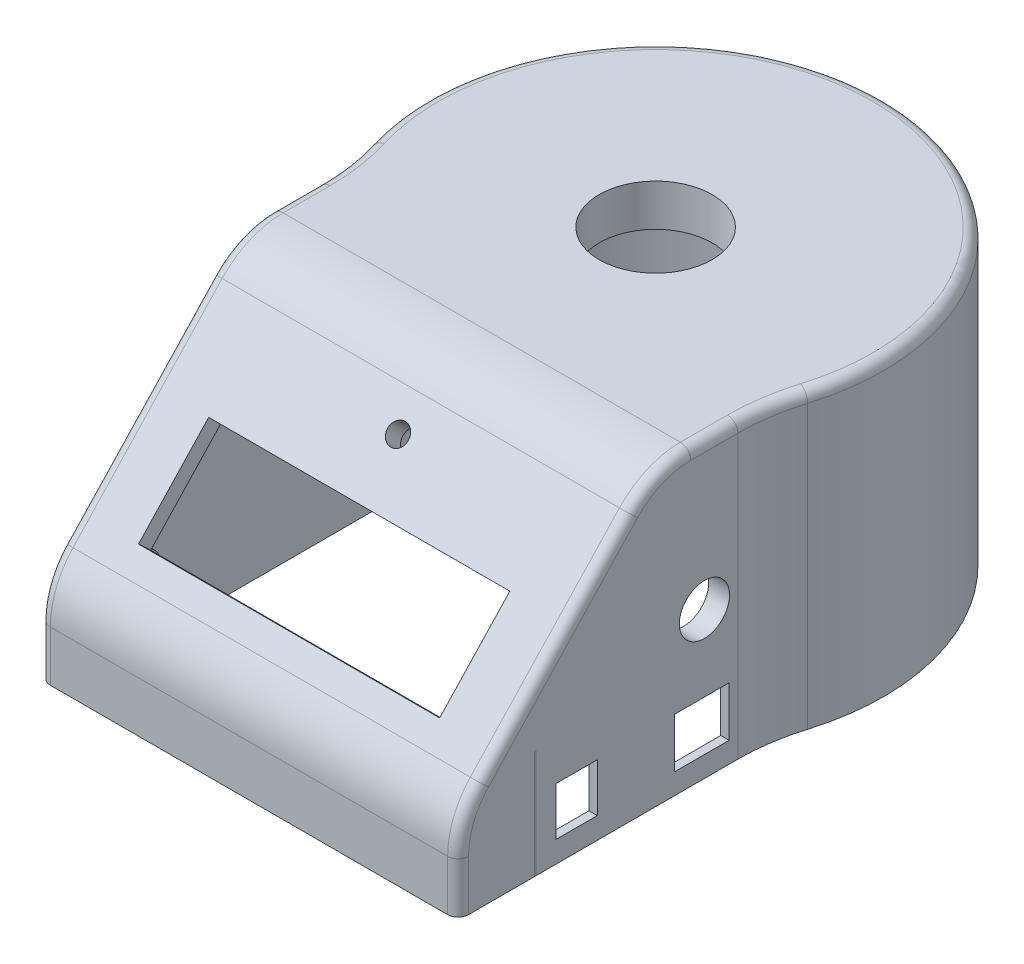
from build123d import *

# Parameters (mm, degrees)
SKETCH1_R                             = 54.5
SKETCH1_R_2                           = 50
BOSS_EXTRUDE1_DEPTH                   = 60
SKETCH2_R                             = 54.5
SKETCH2_R_2                           = 13.5
BOSS_EXTRUDE2_DEPTH                   = 10
BOSS_EXTRUDE4_DEPTH                   = 70
CUT_EXTRUDE3_DEPTH                    = 100
SHELL1_DEPTH                          = 65
SHELL1_START                          = 79.546448744
SHELL1_2_OUTLINE_W                    = 92
SHELL1_2_OUTLINE_H                    = 68
SHELL1_2_DEPTH                        = 5
CUT_EXTRUDE4_DEPTH                    = 60
SKETCH12_W                            = 72
SKETCH12_H                            = 24.5
CUT_EXTRUDE5_DEPTH                    = 4
SKETCH13_W                            = 80
SKETCH13_H                            = 36
CUT_EXTRUDE6_DEPTH                    = 1
SKETCH15_R                            = 2.75
BOSS_EXTRUDE5_DEPTH                   = 7
M3_CLEARANCE_HOLE1_D                  = 3.4
M3_CLEARANCE_HOLE1_DEPTH              = 5
M3_CLEARANCE_HOLE1_CSINK_D            = 3.45
M3_CLEARANCE_HOLE1_CSINK_ANGLE        = 90
M3_CLEARANCE_HOLE1_TIP                = 1.021463052
SKETCH19_R                            = 5
BOSS_EXTRUDE6_DEPTH                   = 15
BOSS_EXTRUDE6_2_DEPTH                 = 15
BOSS_EXTRUDE7_DEPTH                   = 15
SKETCH21_R                            = 5
BOSS_EXTRUDE8_DEPTH                   = 15
TAP_DRILL_FOR_M4X0_7_TAP1_D           = 3.3
TAP_DRILL_FOR_M4X0_7_TAP1_DEPTH       = 15
TAP_DRILL_FOR_M4X0_7_TAP1_CSINK_D     = 3.35
TAP_DRILL_FOR_M4X0_7_TAP1_CSINK_ANGLE = 90
SKETCH24_W                            = 57.3
SKETCH24_H                            = 26
CUT_EXTRUDE7_DEPTH                    = 5
SKETCH25_W                            = 57.3
SKETCH25_H                            = 26
SKETCH25_W_2                          = 12.999996543
SKETCH25_H_2                          = 11.900000274
SKETCH25_W_3                          = 9.900001809
SKETCH25_H_3                          = 11.55991244
BOSS_EXTRUDE9_DEPTH                   = 2
SKETCH26_W                            = 0.338668116
SKETCH26_H                            = 26
BOSS_EXTRUDE10_DEPTH                  = 2
FILLET1_R                             = 50
FILLET2_R                             = 20
FILLET3_R                             = 20
FILLET4_R                             = 2.5
SKETCH27_R                            = 2.5
CUT_EXTRUDE8_DEPTH                    = 5
SKETCH30_W                            = 6
SKETCH30_H                            = 5.001


with BuildPart() as part:
    # Sketch1 → Boss-Extrude1 (new body)
    with BuildSketch(Plane(origin=(0, 0, 0), x_dir=(1, 0, 0), z_dir=(0, 1, 0))):
        with Locations(Location((0, 0, 0), (0, 0, 270))):
            Circle(SKETCH1_R)
        with Locations(Location((0, 0, 0), (0, 0, 270))):
            Circle(SKETCH1_R_2, mode=Mode.SUBTRACT)
    extrude(amount=BOSS_EXTRUDE1_DEPTH)

    # Sketch2 → Boss-Extrude2 (add)
    with BuildSketch(Plane(origin=(0, 60, 0), x_dir=(1, 0, 0), z_dir=(0, 1, 0))):
        with Locations(Location((0, 0, 0), (0, 0, 270))):
            Circle(SKETCH2_R)
        with Locations(Location((0, 0, 0), (0, 0, 270))):
            Circle(SKETCH2_R_2, mode=Mode.SUBTRACT)
    extrude(amount=BOSS_EXTRUDE2_DEPTH)

    # Sketch3 → Boss-Extrude4 (add)
    with BuildSketch(Plane.XZ):
        with BuildLine():
            Line((-50, 0), (-50, 97.235188276))
            Line((-50, 97.235188276), (50, 97.235188276))
            Line((50, 97.235188276), (50, 0))
            ThreePointArc((50, 0), (0, 50), (-50, 0))
        make_face()
    extrude(amount=-BOSS_EXTRUDE4_DEPTH)

    # Sketch4 → Cut-Extrude3 (cut)
    with BuildSketch(Plane(origin=(50, 0, 0), x_dir=(0, 0, -1), z_dir=(1, 0, 0))):
        Polygon((-97.235188276, 70), (-97.235188276, 20), (-50.235188276, 70), align=None)
    extrude(amount=-CUT_EXTRUDE3_DEPTH, mode=Mode.SUBTRACT)

    # Shell1: read off the stored shape, not the designer's step
    # Shell1 outline → Shell1 (cut)
    with BuildSketch(Plane(origin=(0, 0, 0), x_dir=(1, 0, 0), z_dir=(0, 1, 0))):
        with BuildLine():
            Line((45, -92.235188276), (45, -31.622776602))
            ThreePointArc((45, -31.622776602), (0, -55), (-45, -31.622776602))
            Line((-45, -31.622776602), (-45, -92.235188276))
            Line((-45, -92.235188276), (45, -92.235188276))
        make_face()
    extrude(amount=SHELL1_DEPTH, mode=Mode.SUBTRACT)

    # Shell1 2 outline → Shell1 2 (add)
    with BuildSketch(Plane(origin=(0, 0, 0), x_dir=(1, 0, 0), z_dir=(0, 0.6849100087678871, 0.7286276689020071)).offset(SHELL1_START)):
        with Locations((0, -18)):
            Rectangle(SHELL1_2_OUTLINE_W, SHELL1_2_OUTLINE_H)
    extrude(amount=SHELL1_2_DEPTH)

    # Sketch5 → Cut-Extrude4 (cut)
    with BuildSketch(Plane.XZ):
        with BuildLine():
            Line((-45, 31.622776602), (-45, 21.794494718))
            ThreePointArc((-45, 21.794494718), (0, 50), (45, 21.794494718))
            Line((45, 21.794494718), (45, 31.622776602))
            ThreePointArc((45, 31.622776602), (0, 55), (-45, 31.622776602))
        make_face()
    extrude(amount=-CUT_EXTRUDE4_DEPTH, mode=Mode.SUBTRACT)

    # Sketch12 → Cut-Extrude5 (cut)
    with BuildSketch(Plane(origin=(0, 57.906708951, 61.602881862), x_dir=(1, 0, 0), z_dir=(0, 0.6849100087678871, 0.7286276689020071))):
        with Locations((0, -25.774800277)):
            Rectangle(SKETCH12_W, SKETCH12_H)
    extrude(amount=-CUT_EXTRUDE5_DEPTH, mode=Mode.SUBTRACT)

    # Sketch13 → Cut-Extrude6 (cut)
    with BuildSketch(Plane(origin=(0, 54.482158907, 57.959743518), x_dir=(-1, 0, 0), z_dir=(0, -0.6849100087678871, -0.7286276689020071))):
        with Locations((0, -25.024800277)):
            Rectangle(SKETCH13_W, SKETCH13_H)
    extrude(amount=-CUT_EXTRUDE6_DEPTH, mode=Mode.SUBTRACT)

    # Sketch15 → Boss-Extrude5 (add)
    with BuildSketch(Plane(origin=(0, 57.906708951, 61.602881862), x_dir=(1, 0, 0), z_dir=(0, 0.6849100087678871, 0.7286276689020071))):
        with Locations(Location((-37.5, -9.524800277, 0), (0, 0, 270))):
            Circle(SKETCH15_R)
        with Locations(Location((37.5, -9.524800277, 0), (0, 0, 270))):
            Circle(SKETCH15_R)
        with Locations(Location((-37.5, -40.524800277, 0), (0, 0, 270))):
            Circle(SKETCH15_R)
        with Locations(Location((37.5, -40.524800277, 0), (0, 0, 270))):
            Circle(SKETCH15_R)
    extrude(amount=-BOSS_EXTRUDE5_DEPTH)

    # M3 Clearance Hole1
    with Locations(Plane(origin=(0, 53.112338889, 56.50248818), x_dir=(-1, 0, 0), z_dir=(0, -0.6849100087678871, -0.728627668902007))):
        with Locations((-37.5, -9.524800277), (37.5, -9.524800277), (37.5, -40.524800277), (-37.5, -40.524800277)):
            CounterSinkHole(M3_CLEARANCE_HOLE1_D / 2, M3_CLEARANCE_HOLE1_CSINK_D / 2, depth=M3_CLEARANCE_HOLE1_DEPTH, counter_sink_angle=M3_CLEARANCE_HOLE1_CSINK_ANGLE)
            with Locations((0, 0, -(M3_CLEARANCE_HOLE1_DEPTH + M3_CLEARANCE_HOLE1_TIP / 2))):  # 118° drill point
                Cone(0, M3_CLEARANCE_HOLE1_D / 2, M3_CLEARANCE_HOLE1_TIP, mode=Mode.SUBTRACT)



with BuildPart() as body_2:
    # Sketch19 → Boss-Extrude6 (new body)
    with BuildSketch(Plane(origin=(0, 0, 0), x_dir=(-1, 0, 0), z_dir=(0, -1, 0))):
        with Locations(Location((40, -87.235188276, 0), (0, 0, 90))):
            Circle(SKETCH19_R)
    extrude(amount=-BOSS_EXTRUDE6_DEPTH)


with BuildPart() as body_3:
    # Sketch19 → Boss-Extrude6 2 (new body)
    with BuildSketch(Plane(origin=(0, 0, 0), x_dir=(-1, 0, 0), z_dir=(0, -1, 0))):
        with Locations(Location((-40, -87.235188276, 0), (0, 0, 90))):
            Circle(SKETCH19_R)
    extrude(amount=-BOSS_EXTRUDE6_2_DEPTH)


with BuildPart() as part_1:
    add(part.part)

    add(body_2.part)  # Boss-Extrude7 merges body 2

    add(body_3.part)  # Boss-Extrude7 merges body 3
    # Sketch20 → Boss-Extrude7 (add)
    with BuildSketch(Plane.XZ):
        with BuildLine():
            Line((-40, 92.235188276), (-45, 92.235188276))
            Line((-45, 92.235188276), (-45, 87.235188276))
            ThreePointArc((-45, 87.235188276), (-43.535533906, 90.770722182), (-40, 92.235188276))
        make_face()
        with BuildLine():
            Line((40, 92.235188276), (45, 92.235188276))
            Line((45, 92.235188276), (45, 87.235188276))
            ThreePointArc((45, 87.235188276), (43.535533906, 90.770722182), (40, 92.235188276))
        make_face()
    extrude(amount=-BOSS_EXTRUDE7_DEPTH)

    # Sketch21 → Boss-Extrude8 (add)
    with BuildSketch(Plane.XZ):
        with Locations((47, 1.685248442)):
            Circle(SKETCH21_R)
        with Locations((-47, 1.685248442)):
            Circle(SKETCH21_R)
    extrude(amount=-BOSS_EXTRUDE8_DEPTH)

    # Tap Drill for M4x0.7 Tap1
    with Locations(Plane(origin=(-47, 0, 1.685248442), x_dir=(0, 0, -1), z_dir=(0, -1, 0))):
        with Locations((0, 0), (0, 94), (-85.549939834, 87), (-85.549939834, 7)):
            CounterSinkHole(TAP_DRILL_FOR_M4X0_7_TAP1_D / 2, TAP_DRILL_FOR_M4X0_7_TAP1_CSINK_D / 2, depth=TAP_DRILL_FOR_M4X0_7_TAP1_DEPTH, counter_sink_angle=TAP_DRILL_FOR_M4X0_7_TAP1_CSINK_ANGLE)

    # Sketch24 → Cut-Extrude7 (cut)
    with BuildSketch(Plane(origin=(50, 0, 0), x_dir=(0, 0, -1), z_dir=(1, 0, 0))):
        with Locations((-50.335248442, 13)):
            Rectangle(SKETCH24_W, SKETCH24_H)
    extrude(amount=-CUT_EXTRUDE7_DEPTH, mode=Mode.SUBTRACT)

    # Sketch25 → Boss-Extrude9 (add)
    with BuildSketch(Plane(origin=(50, 0, 50), x_dir=(0, 0, 1), z_dir=(1, 0, 0))):
        with Locations((-0.003419674, -13)):
            Rectangle(SKETCH25_W, SKETCH25_H)
        with Locations((-11.053419289, -10.90999946)):
            Rectangle(SKETCH25_W_2, SKETCH25_H_2, mode=Mode.SUBTRACT)
        with Locations((18.896580125, -10.90999946)):
            Rectangle(SKETCH25_W_3, SKETCH25_H_3, mode=Mode.SUBTRACT)
    extrude(amount=-BOSS_EXTRUDE9_DEPTH)

    # Fillet1
    fillet1_edges = [part_1.edges().sort_by_distance(p)[0] for p in [
        (50, 35, 21.685248442),
        (-50, 35, 21.685248442),
    ]]
    fillet(fillet1_edges, radius=FILLET1_R)

    # Fillet2
    fillet2_edges = [part_1.edges().sort_by_distance(p)[0] for p in [
        (0, 20, 97.235188276),
    ]]
    fillet(fillet2_edges, radius=FILLET2_R)

    # Fillet3
    fillet3_edges = [part_1.edges().sort_by_distance(p)[0] for p in [
        (0, 70, 50.235188276),
    ]]
    fillet(fillet3_edges, radius=FILLET3_R)

    # Fillet4
    fillet4_edges = [part_1.edges().sort_by_distance(p)[0] for p in [
        (0, 70, -54.5),
        (-50, 70, 35.960974679),
        (50.541206557, 70, 22.998882804),
        (-50.541206557, 70, 22.998882804),
        (50, 6.037839605, 97.235188276),
        (50, 19.442799829, 95.828884352),
        (-50, 6.037839605, 97.235188276),
        (-50, 19.442799829, 95.828884352),
        (50, 70, 35.960974679),
        (50, 44.73603978, 73.983310883),
        (50, 68.357069531, 49.524714368),
        (-50, 44.73603978, 73.983310883),
        (-50, 68.357069531, 49.524714368),
    ]]
    fillet(fillet4_edges, radius=FILLET4_R)

    # Sketch27 → Cut-Extrude8 (cut)
    with BuildSketch(Plane(origin=(0, 54.482158907, 57.959743518), x_dir=(-1, 0, 0), z_dir=(0, -0.6849100087678871, -0.7286276689020071))):
        with Locations(Location((0, 0, 0), (0, 0, 90))):
            Circle(SKETCH27_R)
    extrude(amount=-CUT_EXTRUDE8_DEPTH, mode=Mode.SUBTRACT)

    # Sketch30 → Hole1 (revolve, cut)
    with BuildSketch(Plane(origin=(50, 35, 38.335622624), x_dir=(0, 0, -1), z_dir=(0, 1, 0))):
        with Locations((3, 2.5005)):
            Rectangle(SKETCH30_W, SKETCH30_H)
    revolve(axis=Axis((-60, 35, 38.335622624), (1, 0, 0)), mode=Mode.SUBTRACT)


with BuildPart() as body_2_2:
    # Sketch26 → Boss-Extrude10 (new body)
    with BuildSketch(Plane(origin=(50, 0, 0), x_dir=(0, 0, -1), z_dir=(1, 0, 0))):
        with Locations((-78.815914384, 13)):
            Rectangle(SKETCH26_W, SKETCH26_H)
    extrude(amount=-BOSS_EXTRUDE10_DEPTH)


solid = Compound([part_1.part, body_2_2.part])
